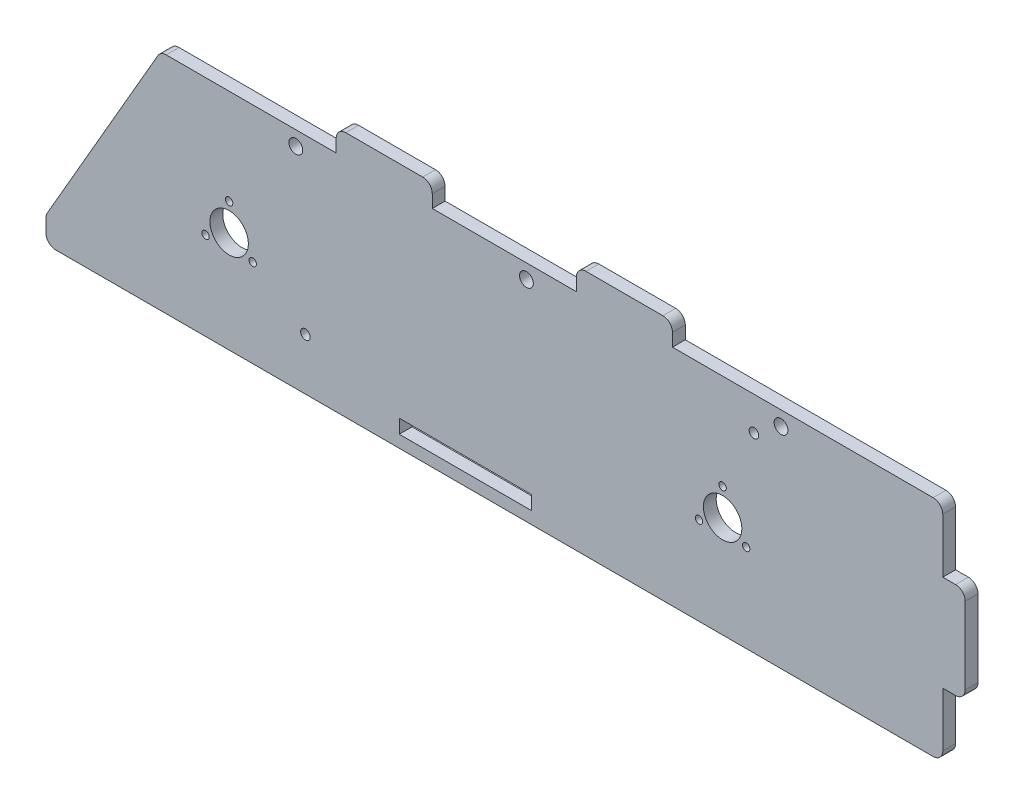
from build123d import *

# Parameters (mm, degrees)
SKETCH1_R           = 6
SKETCH1_R_2         = 1.15
SKETCH1_R_3         = 1.5
SKETCH1_R_4         = 2.15
SKETCH1_W           = 41.3
SKETCH1_H           = 4.35
BOSS_EXTRUDE1_DEPTH = 4
FILLET1_R           = 3


with BuildPart() as part:
    # Sketch1 → Boss-Extrude1 (new body)
    with BuildSketch(Plane.XY):
        Polygon((-128.17175976, -30), (151.82824024, -30), (151.82824024, -10), (158.82824024, -10), (158.82824024, 5), (158.82824024, 20), (151.82824024, 20), (151.82824024, 40), (67.43395693, 40), (67.43395693, 47), (37.43395693, 47), (37.43395693, 40), (-7.56604307, 40), (-7.56604307, 47), (-37.56604307, 47), (-37.56604307, 40), (-92.37604307, 40), (-128.17175976, -22), align=None)
        with Locations((-70.99175976, 1.72)):
            Circle(SKETCH1_R, mode=Mode.SUBTRACT)
        with Locations((-70.99175976, 10.22)):
            Circle(SKETCH1_R_2, mode=Mode.SUBTRACT)
        with Locations((-63.630543828, -2.53)):
            Circle(SKETCH1_R_2, mode=Mode.SUBTRACT)
        with Locations((-78.352975692, -2.53)):
            Circle(SKETCH1_R_2, mode=Mode.SUBTRACT)
        with Locations((83.08824024, 1.72)):
            Circle(SKETCH1_R, mode=Mode.SUBTRACT)
        with Locations((83.08824024, 10.22)):
            Circle(SKETCH1_R_2, mode=Mode.SUBTRACT)
        with Locations((90.449456172, -2.53)):
            Circle(SKETCH1_R_2, mode=Mode.SUBTRACT)
        with Locations((75.727024308, -2.53)):
            Circle(SKETCH1_R_2, mode=Mode.SUBTRACT)
        with Locations((92.86036, 29.5)):
            Circle(SKETCH1_R_3, mode=Mode.SUBTRACT)
        with Locations((-50.17175976, 35.5)):
            Circle(SKETCH1_R_4, mode=Mode.SUBTRACT)
        with Locations((21.82824024, 35.5)):
            Circle(SKETCH1_R_4, mode=Mode.SUBTRACT)
        with Locations((101.32824024, 35.5)):
            Circle(SKETCH1_R_4, mode=Mode.SUBTRACT)
        with Locations((-47.17175976, -13.85)):
            Circle(SKETCH1_R_3, mode=Mode.SUBTRACT)
        with Locations((2.77824024, -24.025)):
            Rectangle(SKETCH1_W, SKETCH1_H, mode=Mode.SUBTRACT)
    extrude(amount=BOSS_EXTRUDE1_DEPTH)

    # Fillet1
    fillet1_edges = [part.edges().sort_by_distance(p)[0] for p in [
        (-128.17175976, -30, 2),
        (-128.17175976, -22, 2),
        (-92.37604307, 40, 2),
        (-37.56604307, 47, 2),
        (-7.56604307, 47, 2),
        (37.43395693, 47, 2),
        (67.43395693, 47, 2),
        (151.82824024, -30, 2),
        (158.82824024, -10, 2),
        (158.82824024, 20, 2),
        (151.82824024, 40, 2),
    ]]
    fillet(fillet1_edges, radius=FILLET1_R)


solid = part.part
